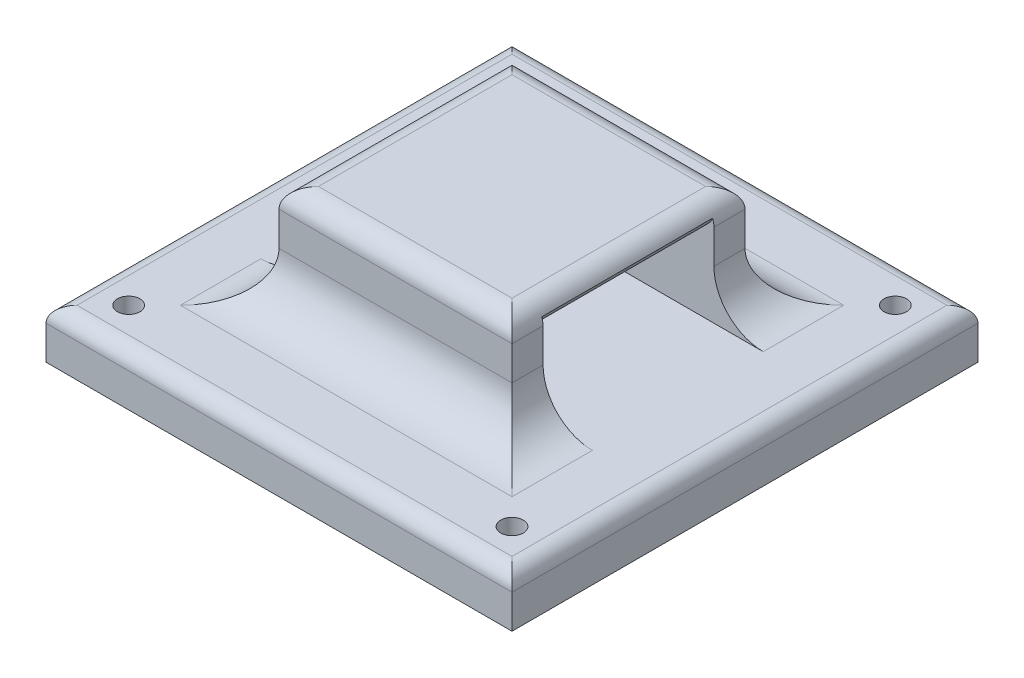
from build123d import *

# Parameters (mm, degrees)
SKETCH2_W           = 30
SKETCH2_H           = 19.6
SKETCH2_W_2         = 22
SKETCH2_H_2         = 10
BOSS_EXTRUDE2_DEPTH = 15
SKETCH3_W           = 60
SKETCH3_H           = 60
BOSS_EXTRUDE3_DEPTH = 6.35
FILLET1_R           = 6.35
FILLET2_R           = 2.54
FILLET3_R           = 2.54
FILLET4_R           = 2
SKETCH4_R           = 1.45
CUT_EXTRUDE1_DEPTH  = 45.447300255


with BuildPart() as part:
    # Sketch2 → Boss-Extrude2 (new, symmetric)
    with BuildSketch(Plane(origin=(0, 0, 0), x_dir=(0, 0, -1), z_dir=(1, 0, 0))):
        with Locations((0, -1.55)):
            Rectangle(SKETCH2_W, SKETCH2_H)
        Rectangle(SKETCH2_W_2, SKETCH2_H_2, mode=Mode.SUBTRACT)
    extrude(amount=BOSS_EXTRUDE2_DEPTH, both=True)

    # Sketch3 → Boss-Extrude3 (add)
    with BuildSketch(Plane.XZ.offset(11.35)):
        Rectangle(SKETCH3_W, SKETCH3_H)
    extrude(amount=-BOSS_EXTRUDE3_DEPTH)

    # Fillet1
    fillet1_edges = [part.edges().sort_by_distance(p)[0] for p in [
        (-15, -5, 13),
        (-15, -5, -13),
        (0, -5, 15),
        (15, -5, 13),
        (15, -5, -13),
        (0, -5, -15),
    ]]
    fillet(fillet1_edges, radius=FILLET1_R)

    # Fillet2
    fillet2_edges = [part.edges().sort_by_distance(p)[0] for p in [
        (-15, 8.25, 0),
        (0, 8.25, 15),
        (0, 8.25, -15),
        (15, 8.25, 0),
    ]]
    fillet(fillet2_edges, radius=FILLET2_R)

    # Fillet3
    # the kernel refuses this fillet: 2.54 mm, written as the material it takes off along each edge
    with BuildSketch(Plane(origin=(-15, 5, -11), x_dir=(0, 1, 0), z_dir=(0, 0, 1))) as fillet3_piece_1:
        with BuildLine():
            CenterArc((FILLET3_R, -FILLET3_R), FILLET3_R, 90, 90)
            Line((0, -FILLET3_R), (0, 0))
            Line((0, 0), (FILLET3_R, 0))
        make_face()
    extrude(amount=22, mode=Mode.SUBTRACT)
    with BuildSketch(Plane(origin=(15, 5, -11), x_dir=(0, 1, 0), z_dir=(0, 0, 1))) as fillet3_piece_2:
        with BuildLine():
            CenterArc((FILLET3_R, FILLET3_R), FILLET3_R, 180, 90)
            Line((0, FILLET3_R), (0, 0))
            Line((0, 0), (FILLET3_R, 0))
        make_face()
    extrude(amount=22, mode=Mode.SUBTRACT)

    # Fillet4
    fillet4_edges = [part.edges().sort_by_distance(p)[0] for p in [
        (0, -5, -30),
        (30, -5, 0),
        (0, -5, 30),
        (-30, -5, 0),
    ]]
    fillet(fillet4_edges, radius=FILLET4_R)

    # Sketch4 → Cut-Extrude1 (cut, through all)
    with BuildSketch(Plane(origin=(0, -5, 0), x_dir=(1, 0, 0), z_dir=(0, 1, 0))):
        with Locations(Location((-24.675, 24.675, 0), (0, 0, 270))):
            Circle(SKETCH4_R)
        with Locations(Location((24.675, 24.675, 0), (0, 0, 270))):
            Circle(SKETCH4_R)
        with Locations(Location((24.675, -24.675, 0), (0, 0, 270))):
            Circle(SKETCH4_R)
        with Locations(Location((-24.675, -24.675, 0), (0, 0, 270))):
            Circle(SKETCH4_R)
    extrude(amount=-CUT_EXTRUDE1_DEPTH, mode=Mode.SUBTRACT)


solid = part.part
